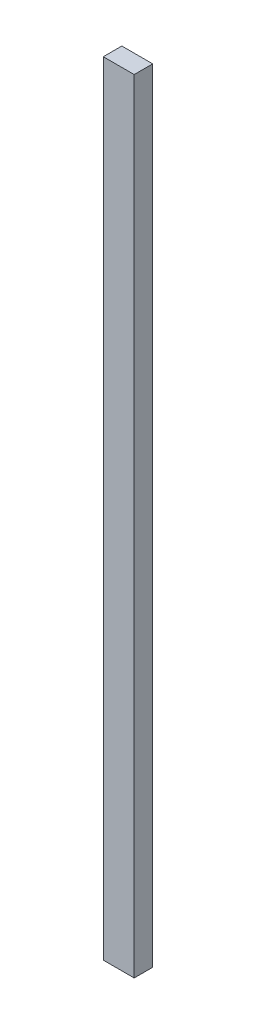
from build123d import *

# Parameters (mm, degrees)
SKETCH1_W           = 30
SKETCH1_H           = 760
BOSS_EXTRUDE1_DEPTH = 18


with BuildPart() as part:
    # Sketch1 → Boss-Extrude1 (new body)
    with BuildSketch(Plane.XY):
        with Locations((70, -391.477864183)):
            Rectangle(SKETCH1_W, SKETCH1_H)
    extrude(amount=BOSS_EXTRUDE1_DEPTH)


solid = part.part
